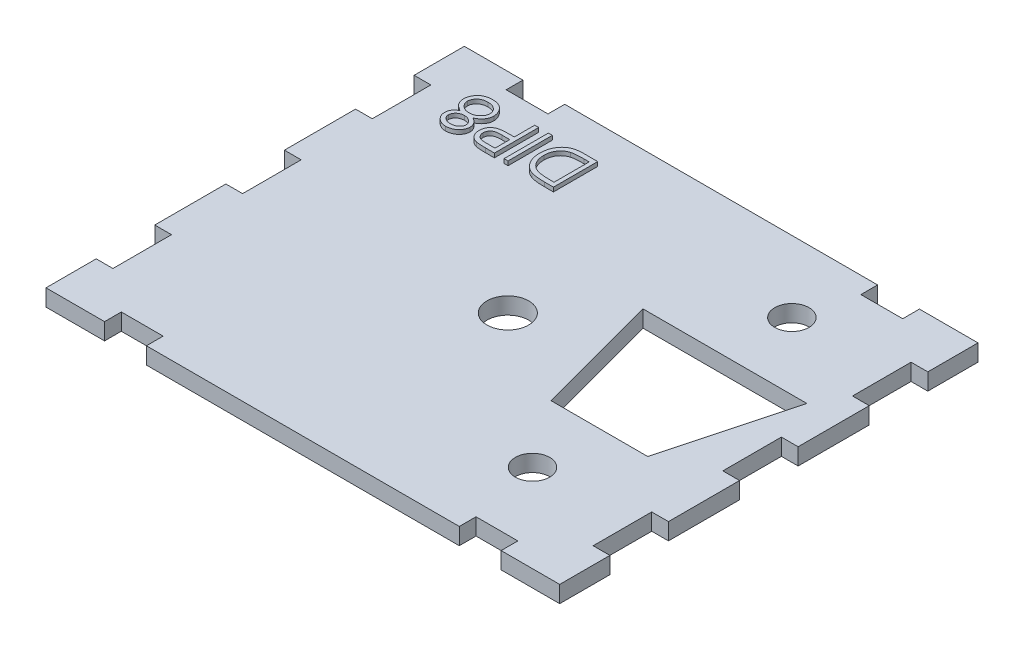
from build123d import *

# Parameters (mm, degrees)
SKETCH2_W           = 100
SKETCH2_H           = 50
BOSS_EXTRUDE1_DEPTH = 2
SKETCH12_W          = 9.8
SKETCH12_H          = 50
SKETCH12_W_2        = 8.8
CUT_EXTRUDE8_DEPTH  = 6
SKETCH13_W          = 5
SKETCH13_H          = 2
CUT_EXTRUDE10_DEPTH = 6
CUT_EXTRUDE13_DEPTH = 10
SKETCH16_R          = 2.5
CUT_EXTRUDE14_DEPTH = 10
SKETCH17_R          = 2.05
CUT_EXTRUDE15_DEPTH = 3.5
SKETCH22_W          = 0.474893163
SKETCH22_H          = 5.291666667
BOSS_EXTRUDE4_DEPTH = 0.5


with BuildPart() as part:
    # Sketch2 → Boss-Extrude1 (new body)
    with BuildSketch(Plane(origin=(0, 0, 0), x_dir=(1, 0, 0), z_dir=(0, 1, 0))):
        Rectangle(SKETCH2_W, SKETCH2_H)
    extrude(amount=BOSS_EXTRUDE1_DEPTH)

    # Sketch12 → Cut-Extrude8 (cut)
    with BuildSketch(Plane(origin=(0, 2, 0), x_dir=(1, 0, 0), z_dir=(0, 1, 0))):
        with Locations((-45.1, 0)):
            Rectangle(SKETCH12_W, SKETCH12_H)
        with Locations((45.6, 0)):
            Rectangle(SKETCH12_W_2, SKETCH12_H)
    extrude(amount=-CUT_EXTRUDE8_DEPTH, mode=Mode.SUBTRACT)

    # Sketch13 → Cut-Extrude10 (cut)
    with BuildSketch(Plane(origin=(0, 2, 0), x_dir=(1, 0, 0), z_dir=(0, 1, 0))):
        Polygon((-28.2, 12), (-28.2, 19), (-30.2, 19), (-30.2, 25), (-40.2, 25), (-40.2, -25), (-30.2, -25), (-30.2, -19), (-28.2, -19), (-28.2, -12), (-30.2, -12), (-30.2, -3.5), (-28.2, -3.5), (-28.2, 3.5), (-30.2, 3.5), (-30.2, 12), align=None)
        with Locations((-20.7, 24)):
            Rectangle(SKETCH13_W, SKETCH13_H)
        with Locations((21.7, 24)):
            Rectangle(SKETCH13_W, SKETCH13_H)
        with Locations((-20.7, -24)):
            Rectangle(SKETCH13_W, SKETCH13_H)
        Polygon((41.2, 25), (31.2, 25), (31.2, 19), (29.2, 19), (29.2, 12), (31.2, 12), (31.2, 3.5), (29.2, 3.5), (29.2, -3.5), (31.2, -3.5), (31.2, -12), (29.2, -12), (29.2, -19), (31.2, -19), (31.2, -25), (41.2, -25), align=None)
        with Locations((21.7, -24)):
            Rectangle(SKETCH13_W, SKETCH13_H)
    extrude(amount=-CUT_EXTRUDE10_DEPTH, mode=Mode.SUBTRACT)

    # Sketch15 → Cut-Extrude13 (cut)
    with BuildSketch(Plane.XZ):
        Polygon((7.666108138, -8.5), (27.239237886, -8.5), (23.22, 6.5), (11.685346024, 6.5), align=None)
    extrude(amount=-CUT_EXTRUDE13_DEPTH, mode=Mode.SUBTRACT)

    # Sketch16 → Cut-Extrude14 (cut)
    with BuildSketch(Plane(origin=(0, 0, 0), x_dir=(-1, 0, 0), z_dir=(0, -1, 0))):
        Circle(SKETCH16_R)
    extrude(amount=-CUT_EXTRUDE14_DEPTH, mode=Mode.SUBTRACT)

    # Sketch17 → Cut-Extrude15 (cut)
    with BuildSketch(Plane(origin=(0, 0, 0), x_dir=(-1, 0, 0), z_dir=(0, -1, 0))):
        with Locations((-17.452672874, -14.5)):
            Circle(SKETCH17_R)
        with Locations((-17.452672903, 16.5)):
            Circle(SKETCH17_R)
    extrude(amount=-CUT_EXTRUDE15_DEPTH, mode=Mode.SUBTRACT)

    # Sketch22 → Boss-Extrude4 (add)
    # profile 1 of 4: a face of its own
    with BuildSketch(Plane(origin=(0, 2, 0), x_dir=(1, 0, 0), z_dir=(0, 1, 0))):
        with BuildLine():
            add(Edge.make_bspline(
                [(-23.289435803, 17.591903377), (-23.332404905, 17.61448406), (-23.416471147, 17.658661691), (-23.536226688, 17.730009944), (-23.647999479, 17.802604298), (-23.749722211, 17.879054809), (-23.842392171, 17.957736407), (-23.926294543, 18.038440897), (-24.002331643, 18.120913039), (-24.067891265, 18.207273039), (-24.126059508, 18.295985161), (-24.175335145, 18.388142762), (-24.218340263, 18.482414147), (-24.252093921, 18.580230551), (-24.279961434, 18.680250068), (-24.299121538, 18.783814795), (-24.309429202, 18.890228595), (-24.31137761, 18.962147422), (-24.312364155, 18.998562365)],
                knots=[0, 0, 0, 0, 1.264219729, 2.473363326, 3.62979159, 4.734286947, 5.785533755, 6.79450939, 7.765315851, 8.704182021, 9.615576613, 10.525715488, 11.423813905, 12.311666436, 13.218214638, 14.126256791, 15.051260205, 16, 16, 16, 16], degree=3))
            add(Edge.make_bspline(
                [(-24.312364155, 18.998562365), (-24.311204378, 19.049512323), (-24.308908743, 19.150361407), (-24.288705392, 19.299170633), (-24.258862371, 19.444279836), (-24.213527962, 19.584044036), (-24.15774182, 19.719654049), (-24.087347083, 19.849282845), (-24.007897509, 19.976651469), (-23.944003353, 20.054992402), (-23.911673049, 20.094632744)],
                knots=[0, 0, 0, 0, 1.02531512, 2.029483338, 3.018748588, 4.004195107, 4.983200899, 5.966616707, 6.971112471, 8, 8, 8, 8], degree=3))
            add(Edge.make_bspline(
                [(-23.911673049, 20.094632744), (-23.869586951, 20.140887617), (-23.785934825, 20.232825779), (-23.642632065, 20.352191884), (-23.485360884, 20.452505849), (-23.314729833, 20.534257404), (-23.131195025, 20.597887215), (-22.934795566, 20.643611021), (-22.725148573, 20.669800885), (-22.581055777, 20.673586679), (-22.50713412, 20.675528845)],
                knots=[0, 0, 0, 0, 0.954267603, 1.896743057, 2.838368354, 3.796610408, 4.779680527, 5.799409237, 6.871065594, 8, 8, 8, 8], degree=3))
            add(Edge.make_bspline(
                [(-22.50713412, 20.675528845), (-22.436055991, 20.673781732), (-22.297745171, 20.670382028), (-22.096400606, 20.64747387), (-21.908487986, 20.606917675), (-21.733116378, 20.552556064), (-21.57198157, 20.480063565), (-21.424790588, 20.391208922), (-21.289386079, 20.287998182), (-21.170015852, 20.167947464), (-21.064068193, 20.039336519), (-20.970919412, 19.906693561), (-20.893932238, 19.770115131), (-20.827575478, 19.631678729), (-20.778193171, 19.488579337), (-20.743167977, 19.342285484), (-20.72116727, 19.193212775), (-20.718224786, 19.09262613), (-20.716744497, 19.04202357)],
                knots=[0, 0, 0, 0, 1.256864279, 2.445730223, 3.576845088, 4.651810441, 5.686528262, 6.692706664, 7.686234615, 8.689148594, 9.678739427, 10.630299996, 11.55097961, 12.448208961, 13.341360817, 14.221834469, 15.105450545, 16, 16, 16, 16], degree=3))
            add(Edge.make_bspline(
                [(-20.716744497, 19.04202357), (-20.717618412, 19.004892494), (-20.719345576, 18.931508382), (-20.731293861, 18.823089499), (-20.750519307, 18.717568868), (-20.776571554, 18.61452999), (-20.812202555, 18.514516547), (-20.854473631, 18.417012756), (-20.904236832, 18.322021441), (-20.963451698, 18.230988823), (-21.028691128, 18.140690304), (-21.106136334, 18.055609622), (-21.190624087, 17.970749255), (-21.287183971, 17.891269556), (-21.390601042, 17.810604383), (-21.505698429, 17.735495922), (-21.628638317, 17.660082318), (-21.716038773, 17.615019626), (-21.760873437, 17.591903377)],
                knots=[0, 0, 0, 0, 0.941575622, 1.860885767, 2.762557628, 3.660168386, 4.552890429, 5.45184204, 6.353736508, 7.268493418, 8.204037487, 9.175167802, 10.182660057, 11.238220596, 12.344046335, 13.507168087, 14.721227736, 16, 16, 16, 16], degree=3))
            add(Edge.make_bspline(
                [(-21.760873437, 17.591903377), (-21.699577858, 17.558340511), (-21.581078052, 17.493455028), (-21.422672491, 17.375729424), (-21.288489585, 17.245915039), (-21.179955341, 17.103816516), (-21.09426206, 16.95410414), (-21.033675933, 16.797566068), (-20.994129984, 16.635948219), (-20.990123942, 16.52574089), (-20.988112018, 16.470392293)],
                knots=[0, 0, 0, 0, 1.16701039, 2.256125286, 3.287752239, 4.277689688, 5.235169525, 6.160862735, 7.076343936, 8, 8, 8, 8], degree=3))
            add(Edge.make_bspline(
                [(-20.988112018, 16.470392293), (-20.99058901, 16.414004539), (-20.995568195, 16.30065532), (-21.035692113, 16.131877426), (-21.101573472, 15.966019636), (-21.18964704, 15.803466302), (-21.301731542, 15.651624337), (-21.434399213, 15.514337341), (-21.587483171, 15.395158449), (-21.757618679, 15.294413112), (-21.940381157, 15.212025645), (-22.133537089, 15.155780959), (-22.333643963, 15.118788779), (-22.46986568, 15.114612288), (-22.538935002, 15.112494657)],
                knots=[0, 0, 0, 0, 0.888724595, 1.786491426, 2.720083884, 3.697804067, 4.69440576, 5.687697823, 6.7000873, 7.744853364, 8.800284131, 9.853047784, 10.91141782, 12, 12, 12, 12], degree=3))
            add(Edge.make_bspline(
                [(-22.538935002, 15.112494657), (-22.606223043, 15.114671942), (-22.738907394, 15.1189653), (-22.934231025, 15.155126734), (-23.121279065, 15.21484513), (-23.299003181, 15.296181802), (-23.463621786, 15.397529675), (-23.610117107, 15.518020117), (-23.739685062, 15.65381121), (-23.846731579, 15.806153981), (-23.932605497, 15.968696476), (-23.994444609, 16.137306704), (-24.0335398, 16.30996329), (-24.038507636, 16.426729958), (-24.040996634, 16.485232704)],
                knots=[0, 0, 0, 0, 1.072634126, 2.115112298, 3.156050586, 4.19761425, 5.225177188, 6.230426315, 7.215180151, 8.209739481, 9.190420596, 10.139012357, 11.067603024, 12, 12, 12, 12], degree=3))
            add(Edge.make_bspline(
                [(-24.040996634, 16.485232704), (-24.038814594, 16.542644763), (-24.034529192, 16.655398782), (-23.998954414, 16.819531188), (-23.938110498, 16.972926268), (-23.856031863, 17.11794444), (-23.748301785, 17.252268321), (-23.617095434, 17.376565011), (-23.464115364, 17.493265493), (-23.348963868, 17.558289128), (-23.289435803, 17.591903377)],
                knots=[0, 0, 0, 0, 0.975463758, 1.915755378, 2.838359076, 3.772025586, 4.738400888, 5.753889765, 6.838863581, 8, 8, 8, 8], degree=3))
        make_face()
        with BuildLine():
            add(Edge.make_bspline(
                [(-22.512434267, 15.655229699), (-22.47531449, 15.656211427), (-22.402691974, 15.658132116), (-22.296228701, 15.668244), (-22.194907486, 15.687667345), (-22.098174266, 15.714277066), (-22.005697671, 15.747384889), (-21.919598353, 15.791005575), (-21.836982884, 15.839490149), (-21.760561541, 15.896360348), (-21.691380821, 15.958406963), (-21.629590243, 16.023204881), (-21.579250098, 16.092664313), (-21.535940626, 16.163310298), (-21.503777294, 16.238073053), (-21.480929572, 16.315315625), (-21.464760061, 16.395527264), (-21.463594687, 16.45017091), (-21.463005181, 16.477812499)],
                knots=[0, 0, 0, 0, 1.20353747, 2.354645537, 3.462130888, 4.543058862, 5.604822423, 6.639552563, 7.666902586, 8.706944258, 9.720926464, 10.677177239, 11.602682187, 12.496457588, 13.358248655, 14.231532794, 15.105417644, 16, 16, 16, 16], degree=3))
            add(Edge.make_bspline(
                [(-21.463005181, 16.477812499), (-21.464080303, 16.505438436), (-21.466204899, 16.560031256), (-21.481582796, 16.640972731), (-21.507294769, 16.719478164), (-21.542551413, 16.796280423), (-21.587796714, 16.871182371), (-21.642711, 16.944471028), (-21.709676985, 17.014208335), (-21.78362764, 17.082372873), (-21.864405646, 17.14517387), (-21.949288635, 17.201271158), (-22.03889609, 17.245991422), (-22.130544476, 17.285201955), (-22.226171939, 17.314614401), (-22.32511912, 17.335804335), (-22.427280324, 17.348911631), (-22.496495028, 17.350482111), (-22.531514796, 17.351276708)],
                knots=[0, 0, 0, 0, 0.873213166, 1.72559466, 2.594724523, 3.479581045, 4.391597569, 5.35687048, 6.368548091, 7.443976143, 8.534559525, 9.600545123, 10.654815915, 11.696401765, 12.749428718, 13.812189468, 14.893058657, 16, 16, 16, 16], degree=3))
            add(Edge.make_bspline(
                [(-22.531514796, 17.351276708), (-22.576496813, 17.349963671), (-22.666016561, 17.347350566), (-22.797934775, 17.322833119), (-22.926524557, 17.284755207), (-23.049352767, 17.230710492), (-23.164221069, 17.164816998), (-23.267889704, 17.087110128), (-23.356020332, 16.995764996), (-23.430997068, 16.896080311), (-23.489618261, 16.790338942), (-23.534523013, 16.683790582), (-23.560967949, 16.575557598), (-23.564405573, 16.503033178), (-23.566103471, 16.467212205)],
                knots=[0, 0, 0, 0, 1.076561449, 2.142489767, 3.202892658, 4.283174188, 5.348766409, 6.369549039, 7.375093932, 8.378927502, 9.349008457, 10.26378795, 11.142457041, 12, 12, 12, 12], degree=3))
            add(Edge.make_bspline(
                [(-23.566103471, 16.467212205), (-23.565314167, 16.442066926), (-23.563747511, 16.392157152), (-23.550314376, 16.318212536), (-23.529362787, 16.245904034), (-23.498822884, 16.175656129), (-23.46187911, 16.1058369), (-23.414787797, 16.03863664), (-23.360211652, 15.972021681), (-23.297362791, 15.908184689), (-23.22635654, 15.848252806), (-23.146618515, 15.796301252), (-23.058852377, 15.752979436), (-22.964234769, 15.716583757), (-22.861765786, 15.689552381), (-22.752327664, 15.669210289), (-22.634932936, 15.65776836), (-22.554152771, 15.656094273), (-22.512434267, 15.655229699)],
                knots=[0, 0, 0, 0, 0.814035228, 1.61574325, 2.427118093, 3.24780647, 4.092880925, 4.981933388, 5.900917883, 6.880367106, 7.87994501, 8.905470125, 9.95492938, 11.0455354, 12.184050453, 13.382997595, 14.64846247, 16, 16, 16, 16], degree=3))
        make_face(mode=Mode.SUBTRACT)
        with BuildLine():
            add(Edge.make_bspline(
                [(-22.543175119, 17.894011751), (-22.496116025, 17.894849043), (-22.403797565, 17.896491606), (-22.268545382, 17.914766395), (-22.138750223, 17.940223154), (-22.014810536, 17.978778768), (-21.897362521, 18.028944861), (-21.784753311, 18.088433254), (-21.678746335, 18.159735969), (-21.579815409, 18.241123996), (-21.489241489, 18.329322244), (-21.409489888, 18.422471375), (-21.342111092, 18.519306541), (-21.287432444, 18.619950223), (-21.245014196, 18.724180672), (-21.213708873, 18.832058714), (-21.195533045, 18.943885259), (-21.192943361, 19.019699148), (-21.191637659, 19.05792401)],
                knots=[0, 0, 0, 0, 1.140332253, 2.237053636, 3.304055028, 4.344690294, 5.377465719, 6.397042765, 7.428360044, 8.469453732, 9.499453352, 10.490108612, 11.438398528, 12.354680514, 13.261581007, 14.161901135, 15.073242693, 16, 16, 16, 16], degree=3))
            add(Edge.make_bspline(
                [(-21.191637659, 19.05792401), (-21.193736865, 19.105436245), (-21.197916883, 19.200044447), (-21.229889104, 19.339513735), (-21.282396734, 19.474495236), (-21.356058748, 19.603085246), (-21.445909182, 19.723724669), (-21.555139911, 19.83036229), (-21.681087775, 19.921562602), (-21.822718051, 19.997787354), (-21.977972565, 20.058158391), (-22.145891871, 20.101349747), (-22.325338543, 20.12849734), (-22.449086216, 20.131339079), (-22.512434267, 20.132793802)],
                knots=[0, 0, 0, 0, 0.899105568, 1.790333855, 2.694925079, 3.632758987, 4.588257081, 5.534574046, 6.511571685, 7.523527334, 8.572244311, 9.657983075, 10.801090915, 12, 12, 12, 12], degree=3))
            add(Edge.make_bspline(
                [(-22.512434267, 20.132793802), (-22.561946272, 20.131832001), (-22.658411534, 20.129958104), (-22.79919616, 20.113761674), (-22.931741394, 20.087305183), (-23.05731706, 20.051433018), (-23.174988471, 20.00388132), (-23.284595238, 19.944817552), (-23.387629904, 19.877353963), (-23.479688966, 19.797482909), (-23.563393287, 19.71201594), (-23.636711674, 19.622016397), (-23.698761577, 19.528385631), (-23.74877976, 19.431178451), (-23.788498975, 19.330752085), (-23.817132006, 19.226694282), (-23.834779351, 19.118596315), (-23.836565569, 19.045270882), (-23.837470993, 19.00810263)],
                knots=[0, 0, 0, 0, 1.224631902, 2.385975653, 3.500340538, 4.565441647, 5.612488581, 6.63322211, 7.641830068, 8.652595074, 9.641693811, 10.598750962, 11.520088299, 12.415429315, 13.298523938, 14.187139574, 15.081071174, 16, 16, 16, 16], degree=3))
            add(Edge.make_bspline(
                [(-23.837470993, 19.00810263), (-23.836110484, 18.971998254), (-23.833427799, 18.900806732), (-23.816156573, 18.795386006), (-23.786507588, 18.69311897), (-23.743274369, 18.594466875), (-23.69018178, 18.49828214), (-23.624595492, 18.40537225), (-23.547314869, 18.315479941), (-23.45852907, 18.230455999), (-23.362305315, 18.151855224), (-23.260329144, 18.082004429), (-23.152135819, 18.024914734), (-23.039868607, 17.976955371), (-22.922395756, 17.939580332), (-22.800283876, 17.913372465), (-22.673301633, 17.896900838), (-22.587040661, 17.89498566), (-22.543175119, 17.894011751)],
                knots=[0, 0, 0, 0, 0.917336384, 1.808827106, 2.706624561, 3.615530867, 4.539869921, 5.493819324, 6.499753197, 7.547410123, 8.613069608, 9.653934021, 10.682176708, 11.716048074, 12.752411263, 13.808993382, 14.885826486, 16, 16, 16, 16], degree=3))
        make_face(mode=Mode.SUBTRACT)
    # profile 2 of 4: a face of its own
    with BuildSketch(Plane(origin=(0, 2, 0), x_dir=(1, 0, 0), z_dir=(0, 1, 0))):
        with BuildLine():
            Line((-16.849757317, 15.248178417), (-17.887526081, 15.248178417))
            add(Edge.make_bspline(
                [(-17.887526081, 15.248178417), (-17.958904475, 15.24825688), (-18.095668647, 15.248407217), (-18.291785458, 15.252965225), (-18.469902552, 15.2590532), (-18.629635866, 15.267492491), (-18.771476871, 15.277465907), (-18.894783741, 15.29145411), (-19.000525689, 15.306059556), (-19.06388425, 15.320908588), (-19.092779486, 15.327680621)],
                knots=[0, 0, 0, 0, 1.415646017, 2.712440637, 3.8905458, 4.950247383, 5.884950622, 6.709939814, 7.411656543, 8, 8, 8, 8], degree=3))
            add(Edge.make_bspline(
                [(-19.092779486, 15.327680621), (-19.129357573, 15.337692681), (-19.201651829, 15.357480878), (-19.305827007, 15.39710916), (-19.404925695, 15.44411866), (-19.499362415, 15.497616299), (-19.587519359, 15.560128491), (-19.672148956, 15.628047242), (-19.7514764, 15.704119349), (-19.824303874, 15.788244656), (-19.891781673, 15.877667251), (-19.948265428, 15.974667362), (-19.998142805, 16.075880016), (-20.0370127, 16.18377635), (-20.06756593, 16.296932148), (-20.089817881, 16.415641918), (-20.104119685, 16.539649576), (-20.105476746, 16.624409671), (-20.106167574, 16.667557758)],
                knots=[0, 0, 0, 0, 0.999333726, 1.975119402, 2.933498163, 3.889020618, 4.832249799, 5.779334906, 6.747801194, 7.724875447, 8.710438469, 9.696133548, 10.679360639, 11.681339199, 12.714023775, 13.766351759, 14.862936069, 16, 16, 16, 16], degree=3))
            add(Edge.make_bspline(
                [(-20.106167574, 16.667557758), (-20.10553042, 16.711067015), (-20.104283785, 16.796195817), (-20.089321544, 16.920735628), (-20.069167564, 17.039750337), (-20.038177973, 17.152976053), (-19.997589872, 17.259740373), (-19.949976887, 17.361674855), (-19.892549407, 17.457045311), (-19.826562581, 17.546197977), (-19.753157194, 17.629216535), (-19.672643823, 17.705499379), (-19.585347512, 17.774599986), (-19.491545693, 17.836673267), (-19.390323898, 17.890279785), (-19.283217308, 17.938293806), (-19.169294957, 17.978617909), (-19.090460442, 17.999830026), (-19.050378311, 18.010614983)],
                knots=[0, 0, 0, 0, 1.121902311, 2.195077645, 3.232258892, 4.234102512, 5.217864754, 6.176164875, 7.132989551, 8.084763148, 9.034132444, 9.988522005, 10.94243251, 11.903244335, 12.886203696, 13.894208494, 14.929344452, 16, 16, 16, 16], degree=3))
            add(Edge.make_bspline(
                [(-19.050378311, 18.010614983), (-19.017225893, 18.017659712), (-18.944570441, 18.033098645), (-18.824921685, 18.050451574), (-18.685544292, 18.064682872), (-18.526912485, 18.077963633), (-18.348656338, 18.085000776), (-18.151184687, 18.09326353), (-17.933829219, 18.097162272), (-17.782230557, 18.097408721), (-17.703080969, 18.097537392)],
                knots=[0, 0, 0, 0, 0.601372724, 1.317943291, 2.144091499, 3.08771165, 4.142394186, 5.309582461, 6.595334295, 8, 8, 8, 8], degree=3))
            Line((-17.703080969, 18.097537392), (-17.32465048, 18.097537392))
            Line((-17.32465048, 18.097537392), (-17.32465048, 20.539845084))
            Line((-17.32465048, 20.539845084), (-16.849757317, 20.539845084))
            Line((-16.849757317, 20.539845084), (-16.849757317, 15.248178417))
        make_face()
        with BuildLine():
            Line((-17.32465048, 15.79091346), (-17.32465048, 17.554802349))
            Line((-17.32465048, 17.554802349), (-18.251116158, 17.566462672))
            add(Edge.make_bspline(
                [(-18.251116158, 17.566462672), (-18.296352998, 17.5664925), (-18.383681785, 17.566550082), (-18.510171515, 17.560421484), (-18.627242279, 17.553754261), (-18.735066925, 17.542971778), (-18.833153313, 17.529820509), (-18.921738923, 17.512237197), (-19.001530711, 17.494303354), (-19.093442015, 17.463184955), (-19.196392314, 17.4162389), (-19.308129847, 17.346119114), (-19.403600406, 17.257785816), (-19.485518732, 17.157394105), (-19.550269573, 17.045594913), (-19.597197314, 16.926308405), (-19.625841034, 16.799987531), (-19.629441306, 16.713641524), (-19.631274411, 16.669677816)],
                knots=[0, 0, 0, 0, 1.160501667, 2.240324542, 3.248665471, 4.168823117, 5.020172044, 5.786515869, 6.485785279, 7.116517804, 8.272762037, 9.381837012, 10.485674779, 11.594342068, 12.695271952, 13.786226926, 14.872841088, 16, 16, 16, 16], degree=3))
            add(Edge.make_bspline(
                [(-19.631274411, 16.669677816), (-19.629359524, 16.627138412), (-19.625552964, 16.54257534), (-19.597433922, 16.418581872), (-19.549772594, 16.300651465), (-19.485465943, 16.189738386), (-19.405510669, 16.089613502), (-19.311938821, 16.003248829), (-19.206206234, 15.933346739), (-19.108619451, 15.886813583), (-19.021286965, 15.859525505), (-18.945795973, 15.839824894), (-18.860125246, 15.826237802), (-18.765085548, 15.81323751), (-18.660798562, 15.802743445), (-18.546601151, 15.795456031), (-18.422873698, 15.791235826), (-18.336981928, 15.791023517), (-18.292457304, 15.79091346)],
                knots=[0, 0, 0, 0, 1.12039168, 2.227199994, 3.330242575, 4.460839274, 5.593542475, 6.693949254, 7.801736126, 8.92216649, 9.528704869, 10.210659466, 10.975987387, 11.81211542, 12.738540127, 13.736887663, 14.826846554, 16, 16, 16, 16], degree=3))
            Line((-18.292457304, 15.79091346), (-17.32465048, 15.79091346))
        make_face(mode=Mode.SUBTRACT)
    # profile 3 of 4: a face of its own
    with BuildSketch(Plane(origin=(0, 2, 0), x_dir=(1, 0, 0), z_dir=(0, 1, 0))):
        with Locations((-15.458998771, 17.89401175)):
            Rectangle(SKETCH22_W, SKETCH22_H)
    # profile 4 of 4: a face of its own
    with BuildSketch(Plane(origin=(0, 2, 0), x_dir=(1, 0, 0), z_dir=(0, 1, 0))):
        with BuildLine():
            Line((-9.794201762, 20.539845084), (-9.794201762, 15.248178417))
            Line((-9.794201762, 15.248178417), (-10.862711377, 15.248178417))
            add(Edge.make_bspline(
                [(-10.862711377, 15.248178417), (-10.955646826, 15.248845718), (-11.135197631, 15.250134939), (-11.394656719, 15.258355989), (-11.634380243, 15.272752196), (-11.854232067, 15.294126465), (-12.054565401, 15.319781578), (-12.235059386, 15.352408477), (-12.396006529, 15.39077992), (-12.494989894, 15.423507319), (-12.541797916, 15.438983706)],
                knots=[0, 0, 0, 0, 1.314317071, 2.539253741, 3.67075822, 4.709970291, 5.662644612, 6.526156501, 7.303037452, 8, 8, 8, 8], degree=3))
            add(Edge.make_bspline(
                [(-12.541797916, 15.438983706), (-12.60302758, 15.462306224), (-12.724098423, 15.508422383), (-12.896386852, 15.595547119), (-13.059127226, 15.693859614), (-13.211034541, 15.805613833), (-13.352443516, 15.929381688), (-13.485133382, 16.064161799), (-13.605300833, 16.21355234), (-13.717090477, 16.372917778), (-13.814935421, 16.543708371), (-13.901215858, 16.722503207), (-13.974886252, 16.908955371), (-14.032368948, 17.104425318), (-14.079859589, 17.307035637), (-14.111724644, 17.518320336), (-14.132891318, 17.737047608), (-14.135008075, 17.885479957), (-14.136082104, 17.960793602)],
                knots=[0, 0, 0, 0, 0.984696416, 1.947063185, 2.89840987, 3.841051395, 4.778753227, 5.721858861, 6.681155121, 7.65838316, 8.646299769, 9.637283673, 10.641736726, 11.657050558, 12.698485921, 13.768600492, 14.86780186, 16, 16, 16, 16], degree=3))
            add(Edge.make_bspline(
                [(-14.136082104, 17.960793602), (-14.135130523, 18.026200252), (-14.133255335, 18.155090889), (-14.116438052, 18.345051132), (-14.09194744, 18.529361241), (-14.054204692, 18.707211928), (-14.007827279, 18.879800613), (-13.950585726, 19.046310112), (-13.882739951, 19.206853596), (-13.804058122, 19.360155912), (-13.71790473, 19.505844287), (-13.624026466, 19.641610381), (-13.525637661, 19.768951073), (-13.4191499, 19.884989597), (-13.308088882, 19.993339426), (-13.188677268, 20.089194152), (-13.064653977, 20.177003811), (-12.932292989, 20.254101774), (-12.790508332, 20.322682703), (-12.63559639, 20.38059971), (-12.468122548, 20.430441608), (-12.286977089, 20.470152222), (-12.092764151, 20.502160991), (-11.884957268, 20.523477188), (-11.66394557, 20.53793223), (-11.512181182, 20.539195085), (-11.434067213, 20.539845084)],
                knots=[0, 0, 0, 0, 1.105894396, 2.179280415, 3.222964075, 4.248423888, 5.251546139, 6.243661943, 7.223682738, 8.196462441, 9.155694589, 10.083899862, 10.986397372, 11.874737962, 12.745335529, 13.607670254, 14.461432187, 15.313100333, 16.195087267, 17.121790994, 18.106827133, 19.14775296, 20.255889161, 21.433815148, 22.679170477, 24, 24, 24, 24], degree=3))
            Line((-11.434067213, 20.539845084), (-9.794201762, 20.539845084))
        make_face()
        with BuildLine():
            Line((-10.269094924, 19.997110041), (-10.876491759, 19.997110041))
            add(Edge.make_bspline(
                [(-10.876491759, 19.997110041), (-10.963771558, 19.996734943), (-11.131642575, 19.996013492), (-11.373030261, 19.98968284), (-11.593586015, 19.979338482), (-11.793341154, 19.964861876), (-11.972182893, 19.945708137), (-12.130484991, 19.924352629), (-12.267728537, 19.897746959), (-12.350776614, 19.873630628), (-12.389153685, 19.86248631)],
                knots=[0, 0, 0, 0, 1.375205317, 2.645023457, 3.804390687, 4.853969522, 5.800190428, 6.637939096, 7.370582563, 8, 8, 8, 8], degree=3))
            add(Edge.make_bspline(
                [(-12.389153685, 19.86248631), (-12.437457592, 19.845476297), (-12.532911669, 19.811862553), (-12.670300372, 19.750524854), (-12.798499649, 19.677957626), (-12.919646715, 19.596817328), (-13.032962998, 19.505851075), (-13.137923739, 19.404769574), (-13.235357997, 19.294743066), (-13.323705759, 19.175400814), (-13.4036093, 19.048066979), (-13.472645697, 18.912883401), (-13.530842597, 18.770608682), (-13.578589285, 18.62173782), (-13.61581533, 18.466182211), (-13.64202393, 18.30355149), (-13.658265092, 18.133909881), (-13.660203698, 18.018425372), (-13.661188941, 17.959733572)],
                knots=[0, 0, 0, 0, 0.998420628, 1.972994, 2.929372424, 3.86770908, 4.81360496, 5.759023883, 6.706048443, 7.676227424, 8.651287839, 9.634325482, 10.632389399, 11.645655052, 12.680158286, 13.74837235, 14.855672678, 16, 16, 16, 16], degree=3))
            add(Edge.make_bspline(
                [(-13.661188941, 17.959733572), (-13.660412073, 17.897846419), (-13.658885907, 17.776268559), (-13.639735283, 17.597872612), (-13.611689968, 17.426319709), (-13.571348971, 17.261486341), (-13.519231881, 17.103586959), (-13.456869559, 16.951729499), (-13.38115191, 16.807868222), (-13.295431527, 16.670784678), (-13.199194698, 16.542554911), (-13.092868326, 16.4246812), (-12.977573557, 16.316943975), (-12.85384175, 16.219171701), (-12.719942925, 16.133103123), (-12.578142913, 16.05653786), (-12.426444272, 15.991483459), (-12.320892138, 15.956895335), (-12.267250306, 15.939317573)],
                knots=[0, 0, 0, 0, 1.122272916, 2.204715076, 3.251197285, 4.274229216, 5.279697671, 6.265416158, 7.248880903, 8.225321784, 9.195852973, 10.153576302, 11.101466393, 12.055578741, 13.010401466, 13.985536859, 14.976245305, 16, 16, 16, 16], degree=3))
            add(Edge.make_bspline(
                [(-12.267250306, 15.939317573), (-12.222874168, 15.927046307), (-12.128518323, 15.900954229), (-11.974546753, 15.872492059), (-11.801259563, 15.847387638), (-11.607887395, 15.826133221), (-11.394650678, 15.810882152), (-11.161385411, 15.799435045), (-10.907990771, 15.791714303), (-10.732333845, 15.791187091), (-10.641165237, 15.79091346)],
                knots=[0, 0, 0, 0, 0.674548936, 1.434276114, 2.292660221, 3.240891867, 4.284742987, 5.42552168, 6.663806718, 8, 8, 8, 8], degree=3))
            Line((-10.641165237, 15.79091346), (-10.269094924, 15.79091346))
            Line((-10.269094924, 15.79091346), (-10.269094924, 19.997110041))
        make_face(mode=Mode.SUBTRACT)
    extrude(amount=BOSS_EXTRUDE4_DEPTH)


solid = part.part
